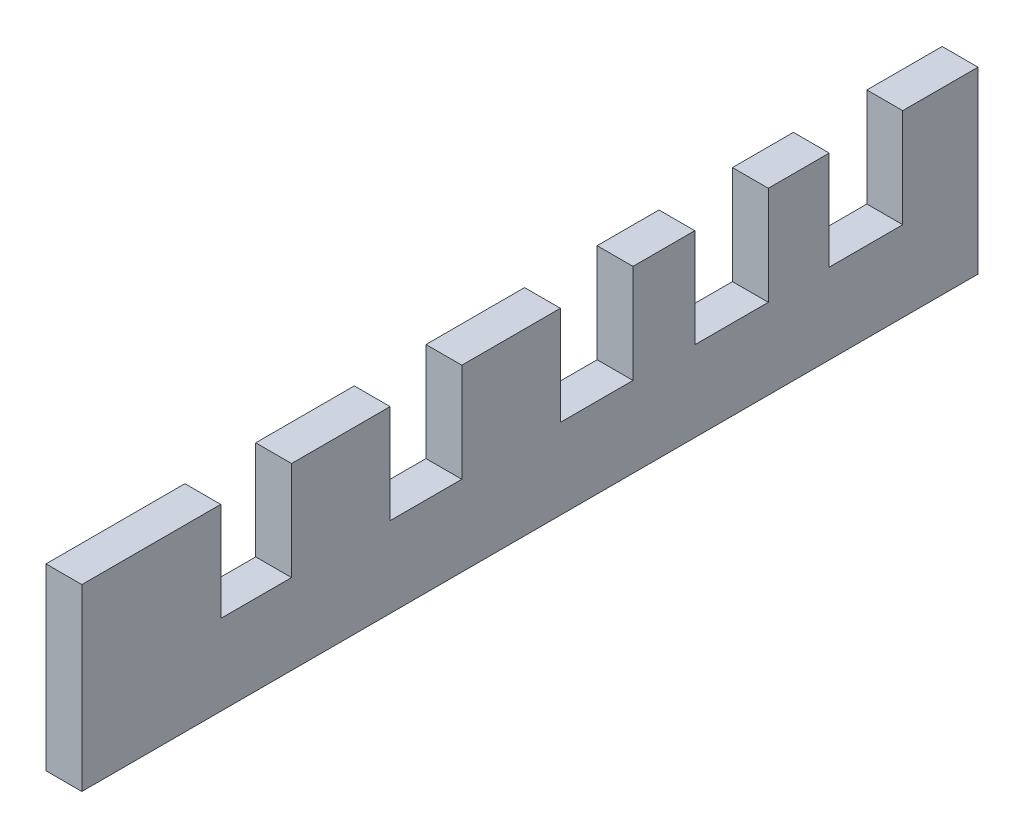
from build123d import *

# Parameters (mm, degrees)
SKETCH1_W               = 5.08
SKETCH1_H               = 25.4
BOSS_EXTRUDE1_DEPTH     = 127
SKETCH7_W               = 10.414
SKETCH7_H               = 16.540612216
SKETCH7_W_2             = 5.334
SKETCH7_H_2             = 11.460612216
SKETCH7_W_3             = 10.033
SKETCH7_W_4             = 4.953
SKETCH7_W_5             = 10.287
SKETCH7_W_6             = 5.207
SKETCH7_W_7             = 10.16
SKETCH7_W_8             = 5.08
CUT_EXTRUDE_THIN1_DEPTH = 130.614684353


with BuildPart() as part:
    # Sketch1 → Boss-Extrude1 (new body)
    with BuildSketch(Plane.XY):
        with Locations((2.54, 12.7)):
            Rectangle(SKETCH1_W, SKETCH1_H)
    extrude(amount=BOSS_EXTRUDE1_DEPTH)

    # Sketch7 → Cut-Extrude-Thin1 (cut, through all)
    # profile 1 of 5: a face of its own
    with BuildSketch(Plane(origin=(5.08, 0, 0), x_dir=(0, 0, -1), z_dir=(1, 0, 0))):
        with Locations((-15.875, 19.669693892)):
            Rectangle(SKETCH7_W, SKETCH7_H)
        with Locations((-15.875, 19.669693892)):
            Rectangle(SKETCH7_W_2, SKETCH7_H_2, mode=Mode.SUBTRACT)
    # profile 2 of 5: a face of its own
    with BuildSketch(Plane(origin=(5.08, 0, 0), x_dir=(0, 0, -1), z_dir=(1, 0, 0))):
        with Locations((-102.2985, 19.669693892)):
            Rectangle(SKETCH7_W_3, SKETCH7_H)
        with Locations((-102.2985, 19.669693892)):
            Rectangle(SKETCH7_W_4, SKETCH7_H_2, mode=Mode.SUBTRACT)
    # profile 3 of 5: a face of its own
    with BuildSketch(Plane(origin=(5.08, 0, 0), x_dir=(0, 0, -1), z_dir=(1, 0, 0))):
        with Locations((-34.925, 19.669693892)):
            Rectangle(SKETCH7_W, SKETCH7_H)
        with Locations((-34.925, 19.669693892)):
            Rectangle(SKETCH7_W_2, SKETCH7_H_2, mode=Mode.SUBTRACT)
    # profile 4 of 5: a face of its own
    with BuildSketch(Plane(origin=(5.08, 0, 0), x_dir=(0, 0, -1), z_dir=(1, 0, 0))):
        with Locations((-54.0385, 19.669693892)):
            Rectangle(SKETCH7_W_5, SKETCH7_H)
        with Locations((-54.0385, 19.669693892)):
            Rectangle(SKETCH7_W_6, SKETCH7_H_2, mode=Mode.SUBTRACT)
    # profile 5 of 5: a face of its own
    with BuildSketch(Plane(origin=(5.08, 0, 0), x_dir=(0, 0, -1), z_dir=(1, 0, 0))):
        with Locations((-78.232, 19.669693892)):
            Rectangle(SKETCH7_W_7, SKETCH7_H)
        with Locations((-78.232, 19.669693892)):
            Rectangle(SKETCH7_W_8, SKETCH7_H_2, mode=Mode.SUBTRACT)
    extrude(amount=-CUT_EXTRUDE_THIN1_DEPTH, mode=Mode.SUBTRACT)


with BuildPart() as cut_extrude_thin1_kept_piece:
    # of the separate pieces the step leaves, the one the design keeps (cut_extrude_thin1_pieces_kept)
    add(part.part.solids().sort_by_distance((0, 0, 0))[0])


solid = cut_extrude_thin1_kept_piece.part
